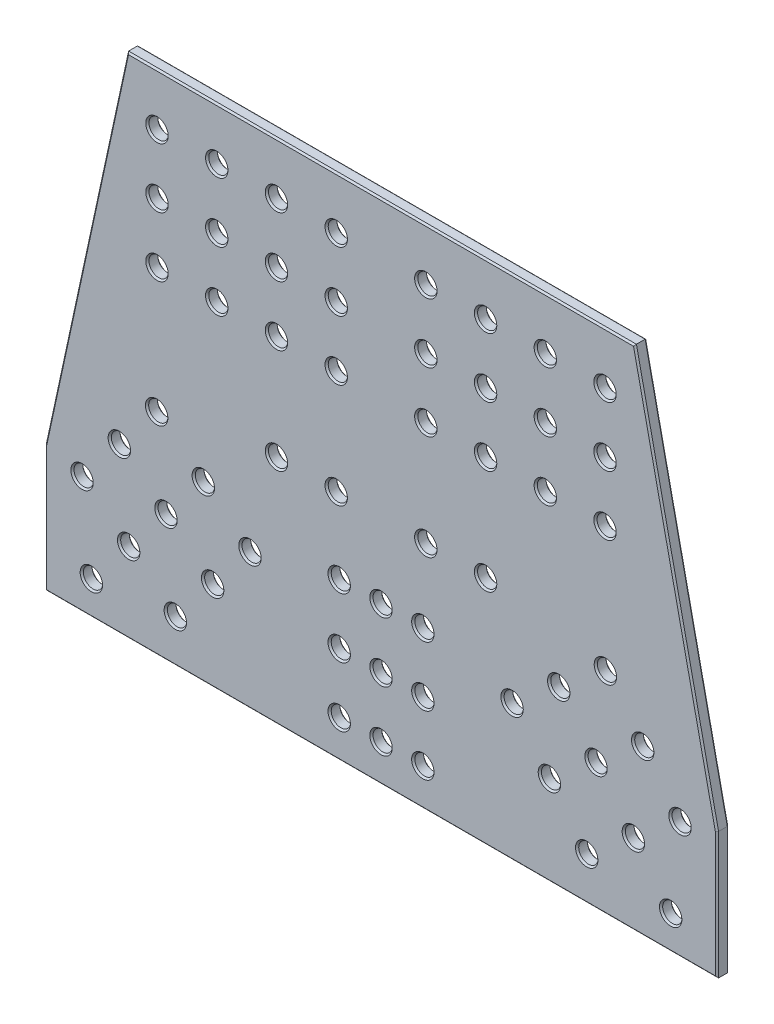
from build123d import *

# Parameters (mm, degrees)
SKETCH_2_R                        = 13
EXTRUDE_1206_DEPTH                = 16
SKETCH_3_R                        = 13
CUT_EXTRUDE_1_DEPTH               = 1129.120560933
PATTERN_LINEAR_1_COUNT            = 4
PATTERN_LINEAR_1_PITCH            = 80
PATTERN_LINEAR_1_COUNT_DIR2       = 3
PATTERN_LINEAR_1_PITCH_DIR2       = 80
PATTERN_LINEAR_2_COUNT            = 2
PATTERN_LINEAR_2_PITCH            = 360
PATTERN_LINEAR_2_COPY_1_SKETCH_R  = 13
PATTERN_LINEAR_2_COPY_1_DEPTH     = 1129.120560933
PATTERN_LINEAR_2_COPY_2_SKETCH_R  = 13
PATTERN_LINEAR_2_COPY_2_DEPTH     = 1129.120560933
PATTERN_LINEAR_2_COPY_3_SKETCH_R  = 13
PATTERN_LINEAR_2_COPY_3_DEPTH     = 1129.120560933
PATTERN_LINEAR_2_COPY_4_SKETCH_R  = 13
PATTERN_LINEAR_2_COPY_4_DEPTH     = 1129.120560933
PATTERN_LINEAR_2_COPY_5_SKETCH_R  = 13
PATTERN_LINEAR_2_COPY_5_DEPTH     = 1129.120560933
PATTERN_LINEAR_2_COPY_6_SKETCH_R  = 13
PATTERN_LINEAR_2_COPY_6_DEPTH     = 1129.120560933
PATTERN_LINEAR_2_COPY_7_SKETCH_R  = 13
PATTERN_LINEAR_2_COPY_7_DEPTH     = 1129.120560933
PATTERN_LINEAR_2_COPY_8_SKETCH_R  = 13
PATTERN_LINEAR_2_COPY_8_DEPTH     = 1129.120560933
PATTERN_LINEAR_2_COPY_9_SKETCH_R  = 13
PATTERN_LINEAR_2_COPY_9_DEPTH     = 1129.120560933
PATTERN_LINEAR_2_COPY_10_SKETCH_R = 13
PATTERN_LINEAR_2_COPY_10_DEPTH    = 1129.120560933
PATTERN_LINEAR_2_COPY_11_SKETCH_R = 13
PATTERN_LINEAR_2_COPY_11_DEPTH    = 1129.120560933
CHAMFER_11_SIZE                   = 2.300736814
CHAMFER_11_SIZE_2                 = 2


with BuildPart() as part:
    # 草图2 → Extrude 1206 (new body)
    with BuildSketch(Plane.XY):
        Polygon((110, 680), (0, 170), (0, 0), (900, 0), (900, 170), (790, 680), align=None)
        with Locations((450, 50)):
            Circle(SKETCH_2_R, mode=Mode.SUBTRACT)
        with Locations((450, 130)):
            Circle(SKETCH_2_R, mode=Mode.SUBTRACT)
        with Locations((450, 210)):
            Circle(SKETCH_2_R, mode=Mode.SUBTRACT)
        with Locations((837.882573403, 45.038033192)):
            Circle(SKETCH_2_R, mode=Mode.SUBTRACT)
        with Locations(Location((62.117426597, 45.038033192, 0), (0, 0, 180))):
            Circle(SKETCH_2_R, mode=Mode.SUBTRACT)
        with Locations((506, 210)):
            Circle(SKETCH_2_R, mode=Mode.SUBTRACT)
        with Locations((506, 130)):
            Circle(SKETCH_2_R, mode=Mode.SUBTRACT)
        with Locations((506, 50)):
            Circle(SKETCH_2_R, mode=Mode.SUBTRACT)
        with Locations(Location((394, 50, 0), (0, 0, 180))):
            Circle(SKETCH_2_R, mode=Mode.SUBTRACT)
        with Locations(Location((394, 130, 0), (0, 0, 180))):
            Circle(SKETCH_2_R, mode=Mode.SUBTRACT)
        with Locations(Location((394, 210, 0), (0, 0, 180))):
            Circle(SKETCH_2_R, mode=Mode.SUBTRACT)
        with Locations((510, 310)):
            Circle(SKETCH_2_R, mode=Mode.SUBTRACT)
        with Locations((590, 310)):
            Circle(SKETCH_2_R, mode=Mode.SUBTRACT)
        with Locations(Location((310, 310, 0), (0, 0, 180))):
            Circle(SKETCH_2_R, mode=Mode.SUBTRACT)
        with Locations(Location((390, 310, 0), (0, 0, 180))):
            Circle(SKETCH_2_R, mode=Mode.SUBTRACT)
        with Locations((750.451236411, 282.431717421)):
            Circle(SKETCH_2_R, mode=Mode.SUBTRACT)
        with Locations((687.976264841, 232.4629479)):
            Circle(SKETCH_2_R, mode=Mode.SUBTRACT)
        with Locations((800.420005931, 219.956745851)):
            Circle(SKETCH_2_R, mode=Mode.SUBTRACT)
        with Locations((850.388775452, 157.481774282)):
            Circle(SKETCH_2_R, mode=Mode.SUBTRACT)
        with Locations((787.913803882, 107.513004761)):
            Circle(SKETCH_2_R, mode=Mode.SUBTRACT)
        with Locations((737.945034362, 169.987976331)):
            Circle(SKETCH_2_R, mode=Mode.SUBTRACT)
        with Locations(Location((725.438832313, 57.544235241, 0), (0, 0, 180))):
            Circle(SKETCH_2_R, mode=Mode.SUBTRACT)
        with Locations(Location((675.470062792, 120.01920681, 0), (0, 0, 180))):
            Circle(SKETCH_2_R, mode=Mode.SUBTRACT)
        with Locations(Location((625.501293272, 182.49417838, 0), (0, 0, 180))):
            Circle(SKETCH_2_R, mode=Mode.SUBTRACT)
        with Locations((274.498706728, 182.49417838)):
            Circle(SKETCH_2_R, mode=Mode.SUBTRACT)
        with Locations((224.529937208, 120.01920681)):
            Circle(SKETCH_2_R, mode=Mode.SUBTRACT)
        with Locations((174.561167687, 57.544235241)):
            Circle(SKETCH_2_R, mode=Mode.SUBTRACT)
        with Locations(Location((162.054965638, 169.987976331, 0), (0, 0, 180))):
            Circle(SKETCH_2_R, mode=Mode.SUBTRACT)
        with Locations(Location((112.086196118, 107.513004761, 0), (0, 0, 180))):
            Circle(SKETCH_2_R, mode=Mode.SUBTRACT)
        with Locations(Location((49.611224548, 157.481774282, 0), (0, 0, 180))):
            Circle(SKETCH_2_R, mode=Mode.SUBTRACT)
        with Locations(Location((99.579994069, 219.956745851, 0), (0, 0, 180))):
            Circle(SKETCH_2_R, mode=Mode.SUBTRACT)
        with Locations(Location((212.023735159, 232.4629479, 0), (0, 0, 180))):
            Circle(SKETCH_2_R, mode=Mode.SUBTRACT)
        with Locations(Location((149.548763589, 282.431717421, 0), (0, 0, 180))):
            Circle(SKETCH_2_R, mode=Mode.SUBTRACT)
    extrude(amount=EXTRUDE_1206_DEPTH)

    # 草图3 → 切除-拉伸1 (cut, through all)
    with BuildSketch(Plane.XY.offset(16)):
        with Locations((750, 610)):
            Circle(SKETCH_3_R)
    cut_extrude_1 = extrude(amount=-CUT_EXTRUDE_1_DEPTH, mode=Mode.SUBTRACT)

    # 阵列(线性)1: Cut-Extrude 1 4 × 3
    with Locations(*[(-i * PATTERN_LINEAR_1_PITCH, -j * PATTERN_LINEAR_1_PITCH_DIR2, 0) for i in range(PATTERN_LINEAR_1_COUNT) for j in range(PATTERN_LINEAR_1_COUNT_DIR2) if (i, j) != (0, 0)]):
        add(cut_extrude_1, mode=Mode.SUBTRACT)

    # 阵列(线性)2: 切除-拉伸1 ×2
    with Locations(*[(-i * PATTERN_LINEAR_2_PITCH, 0, 0) for i in range(1, PATTERN_LINEAR_2_COUNT)]):
        add(cut_extrude_1, mode=Mode.SUBTRACT)

    # 阵列(线性)2 copy 1 sketch → 阵列(线性)2 copy 1 (cut, through all)
    with BuildSketch(Plane(origin=(-360, -80, 16), x_dir=(1, 0, 0), z_dir=(0, 0, 1))):
        with Locations((750, 610)):
            Circle(PATTERN_LINEAR_2_COPY_1_SKETCH_R)
    extrude(amount=-PATTERN_LINEAR_2_COPY_1_DEPTH, mode=Mode.SUBTRACT)

    # 阵列(线性)2 copy 2 sketch → 阵列(线性)2 copy 2 (cut, through all)
    with BuildSketch(Plane(origin=(-360, -160, 16), x_dir=(1, 0, 0), z_dir=(0, 0, 1))):
        with Locations((750, 610)):
            Circle(PATTERN_LINEAR_2_COPY_2_SKETCH_R)
    extrude(amount=-PATTERN_LINEAR_2_COPY_2_DEPTH, mode=Mode.SUBTRACT)

    # 阵列(线性)2 copy 3 sketch → 阵列(线性)2 copy 3 (cut, through all)
    with BuildSketch(Plane(origin=(-440, 0, 16), x_dir=(1, 0, 0), z_dir=(0, 0, 1))):
        with Locations((750, 610)):
            Circle(PATTERN_LINEAR_2_COPY_3_SKETCH_R)
    extrude(amount=-PATTERN_LINEAR_2_COPY_3_DEPTH, mode=Mode.SUBTRACT)

    # 阵列(线性)2 copy 4 sketch → 阵列(线性)2 copy 4 (cut, through all)
    with BuildSketch(Plane(origin=(-440, -80, 16), x_dir=(1, 0, 0), z_dir=(0, 0, 1))):
        with Locations((750, 610)):
            Circle(PATTERN_LINEAR_2_COPY_4_SKETCH_R)
    extrude(amount=-PATTERN_LINEAR_2_COPY_4_DEPTH, mode=Mode.SUBTRACT)

    # 阵列(线性)2 copy 5 sketch → 阵列(线性)2 copy 5 (cut, through all)
    with BuildSketch(Plane(origin=(-440, -160, 16), x_dir=(1, 0, 0), z_dir=(0, 0, 1))):
        with Locations((750, 610)):
            Circle(PATTERN_LINEAR_2_COPY_5_SKETCH_R)
    extrude(amount=-PATTERN_LINEAR_2_COPY_5_DEPTH, mode=Mode.SUBTRACT)

    # 阵列(线性)2 copy 6 sketch → 阵列(线性)2 copy 6 (cut, through all)
    with BuildSketch(Plane(origin=(-520, 0, 16), x_dir=(1, 0, 0), z_dir=(0, 0, 1))):
        with Locations((750, 610)):
            Circle(PATTERN_LINEAR_2_COPY_6_SKETCH_R)
    extrude(amount=-PATTERN_LINEAR_2_COPY_6_DEPTH, mode=Mode.SUBTRACT)

    # 阵列(线性)2 copy 7 sketch → 阵列(线性)2 copy 7 (cut, through all)
    with BuildSketch(Plane(origin=(-520, -80, 16), x_dir=(1, 0, 0), z_dir=(0, 0, 1))):
        with Locations((750, 610)):
            Circle(PATTERN_LINEAR_2_COPY_7_SKETCH_R)
    extrude(amount=-PATTERN_LINEAR_2_COPY_7_DEPTH, mode=Mode.SUBTRACT)

    # 阵列(线性)2 copy 8 sketch → 阵列(线性)2 copy 8 (cut, through all)
    with BuildSketch(Plane(origin=(-520, -160, 16), x_dir=(1, 0, 0), z_dir=(0, 0, 1))):
        with Locations((750, 610)):
            Circle(PATTERN_LINEAR_2_COPY_8_SKETCH_R)
    extrude(amount=-PATTERN_LINEAR_2_COPY_8_DEPTH, mode=Mode.SUBTRACT)

    # 阵列(线性)2 copy 9 sketch → 阵列(线性)2 copy 9 (cut, through all)
    with BuildSketch(Plane(origin=(-600, 0, 16), x_dir=(1, 0, 0), z_dir=(0, 0, 1))):
        with Locations((750, 610)):
            Circle(PATTERN_LINEAR_2_COPY_9_SKETCH_R)
    extrude(amount=-PATTERN_LINEAR_2_COPY_9_DEPTH, mode=Mode.SUBTRACT)

    # 阵列(线性)2 copy 10 sketch → 阵列(线性)2 copy 10 (cut, through all)
    with BuildSketch(Plane(origin=(-600, -80, 16), x_dir=(1, 0, 0), z_dir=(0, 0, 1))):
        with Locations((750, 610)):
            Circle(PATTERN_LINEAR_2_COPY_10_SKETCH_R)
    extrude(amount=-PATTERN_LINEAR_2_COPY_10_DEPTH, mode=Mode.SUBTRACT)

    # 阵列(线性)2 copy 11 sketch → 阵列(线性)2 copy 11 (cut, through all)
    with BuildSketch(Plane(origin=(-600, -160, 16), x_dir=(1, 0, 0), z_dir=(0, 0, 1))):
        with Locations((750, 610)):
            Circle(PATTERN_LINEAR_2_COPY_11_SKETCH_R)
    extrude(amount=-PATTERN_LINEAR_2_COPY_11_DEPTH, mode=Mode.SUBTRACT)

    # 倒角11
    # the kernel refuses this chamfer: 2.300736814, 2 mm, written as the material it takes off along each edge
    with BuildSketch(Plane(origin=(900, -5.927403035, 16), x_dir=(-1, 0, 0), z_dir=(0, 1, 0))) as chamfer_11_piece_1:
        Polygon((CHAMFER_11_SIZE, 0), (0, -CHAMFER_11_SIZE_2), (0, 0), align=None)
    extrude(amount=193.70961214, mode=Mode.SUBTRACT)
    with BuildSketch(Plane(origin=(274.498706728, 182.49417838, 0), x_dir=(1, 0, 0), z_dir=(0, -1, 0))) as chamfer_11_piece_2:
        Polygon((13 + CHAMFER_11_SIZE, 0), (13, CHAMFER_11_SIZE_2), (13, 0), align=None)
    revolve(axis=Axis((274.498706728, 182.49417838, 0), (0, 0, 1)), mode=Mode.SUBTRACT)
    with BuildSketch(Plane(origin=(274.498706728, 182.49417838, 16), x_dir=(1, 0, 0), z_dir=(0, -1, 0))) as chamfer_11_piece_3:
        Polygon((13 + CHAMFER_11_SIZE_2, 0), (13, -CHAMFER_11_SIZE), (13, 0), align=None)
    revolve(axis=Axis((274.498706728, 182.49417838, 16), (0, 0, 1)), mode=Mode.SUBTRACT)
    with BuildSketch(Plane(origin=(224.529937208, 120.01920681, 0), x_dir=(1, 0, 0), z_dir=(0, -1, 0))) as chamfer_11_piece_4:
        Polygon((13 + CHAMFER_11_SIZE, 0), (13, CHAMFER_11_SIZE_2), (13, 0), align=None)
    revolve(axis=Axis((224.529937208, 120.01920681, 0), (0, 0, 1)), mode=Mode.SUBTRACT)
    with BuildSketch(Plane(origin=(224.529937208, 120.01920681, 16), x_dir=(1, 0, 0), z_dir=(0, -1, 0))) as chamfer_11_piece_5:
        Polygon((13 + CHAMFER_11_SIZE_2, 0), (13, -CHAMFER_11_SIZE), (13, 0), align=None)
    revolve(axis=Axis((224.529937208, 120.01920681, 16), (0, 0, 1)), mode=Mode.SUBTRACT)
    with BuildSketch(Plane(origin=(174.561167687, 57.544235241, 0), x_dir=(1, 0, 0), z_dir=(0, -1, 0))) as chamfer_11_piece_6:
        Polygon((13 + CHAMFER_11_SIZE, 0), (13, CHAMFER_11_SIZE_2), (13, 0), align=None)
    revolve(axis=Axis((174.561167687, 57.544235241, 0), (0, 0, 1)), mode=Mode.SUBTRACT)
    with BuildSketch(Plane(origin=(174.561167687, 57.544235241, 16), x_dir=(1, 0, 0), z_dir=(0, -1, 0))) as chamfer_11_piece_7:
        Polygon((13 + CHAMFER_11_SIZE_2, 0), (13, -CHAMFER_11_SIZE), (13, 0), align=None)
    revolve(axis=Axis((174.561167687, 57.544235241, 16), (0, 0, 1)), mode=Mode.SUBTRACT)
    with BuildSketch(Plane(origin=(162.054965638, 169.987976331, 0), x_dir=(-1, 0, 0), z_dir=(0, 1, 0))) as chamfer_11_piece_8:
        Polygon((13 + CHAMFER_11_SIZE, 0), (13, CHAMFER_11_SIZE_2), (13, 0), align=None)
    revolve(axis=Axis((162.054965638, 169.987976331, 0), (0, 0, 1)), mode=Mode.SUBTRACT)
    with BuildSketch(Plane(origin=(162.054965638, 169.987976331, 16), x_dir=(-1, 0, 0), z_dir=(0, 1, 0))) as chamfer_11_piece_9:
        Polygon((13 + CHAMFER_11_SIZE_2, 0), (13, -CHAMFER_11_SIZE), (13, 0), align=None)
    revolve(axis=Axis((162.054965638, 169.987976331, 16), (0, 0, 1)), mode=Mode.SUBTRACT)
    with BuildSketch(Plane(origin=(112.086196118, 107.513004761, 0), x_dir=(-1, 0, 0), z_dir=(0, 1, 0))) as chamfer_11_piece_10:
        Polygon((13 + CHAMFER_11_SIZE, 0), (13, CHAMFER_11_SIZE_2), (13, 0), align=None)
    revolve(axis=Axis((112.086196118, 107.513004761, 0), (0, 0, 1)), mode=Mode.SUBTRACT)
    with BuildSketch(Plane(origin=(112.086196118, 107.513004761, 16), x_dir=(-1, 0, 0), z_dir=(0, 1, 0))) as chamfer_11_piece_11:
        Polygon((13 + CHAMFER_11_SIZE_2, 0), (13, -CHAMFER_11_SIZE), (13, 0), align=None)
    revolve(axis=Axis((112.086196118, 107.513004761, 16), (0, 0, 1)), mode=Mode.SUBTRACT)
    with BuildSketch(Plane(origin=(49.611224548, 157.481774282, 0), x_dir=(-1, 0, 0), z_dir=(0, 1, 0))) as chamfer_11_piece_12:
        Polygon((13 + CHAMFER_11_SIZE, 0), (13, CHAMFER_11_SIZE_2), (13, 0), align=None)
    revolve(axis=Axis((49.611224548, 157.481774282, 0), (0, 0, 1)), mode=Mode.SUBTRACT)
    with BuildSketch(Plane(origin=(49.611224548, 157.481774282, 16), x_dir=(-1, 0, 0), z_dir=(0, 1, 0))) as chamfer_11_piece_13:
        Polygon((13 + CHAMFER_11_SIZE_2, 0), (13, -CHAMFER_11_SIZE), (13, 0), align=None)
    revolve(axis=Axis((49.611224548, 157.481774282, 16), (0, 0, 1)), mode=Mode.SUBTRACT)
    with BuildSketch(Plane(origin=(99.579994069, 219.956745851, 0), x_dir=(-1, 0, 0), z_dir=(0, 1, 0))) as chamfer_11_piece_14:
        Polygon((13 + CHAMFER_11_SIZE, 0), (13, CHAMFER_11_SIZE_2), (13, 0), align=None)
    revolve(axis=Axis((99.579994069, 219.956745851, 0), (0, 0, 1)), mode=Mode.SUBTRACT)
    with BuildSketch(Plane(origin=(99.579994069, 219.956745851, 16), x_dir=(-1, 0, 0), z_dir=(0, 1, 0))) as chamfer_11_piece_15:
        Polygon((13 + CHAMFER_11_SIZE_2, 0), (13, -CHAMFER_11_SIZE), (13, 0), align=None)
    revolve(axis=Axis((99.579994069, 219.956745851, 16), (0, 0, 1)), mode=Mode.SUBTRACT)
    with BuildSketch(Plane(origin=(212.023735159, 232.4629479, 0), x_dir=(-1, 0, 0), z_dir=(0, 1, 0))) as chamfer_11_piece_16:
        Polygon((13 + CHAMFER_11_SIZE, 0), (13, CHAMFER_11_SIZE_2), (13, 0), align=None)
    revolve(axis=Axis((212.023735159, 232.4629479, 0), (0, 0, 1)), mode=Mode.SUBTRACT)
    with BuildSketch(Plane(origin=(212.023735159, 232.4629479, 16), x_dir=(-1, 0, 0), z_dir=(0, 1, 0))) as chamfer_11_piece_17:
        Polygon((13 + CHAMFER_11_SIZE_2, 0), (13, -CHAMFER_11_SIZE), (13, 0), align=None)
    revolve(axis=Axis((212.023735159, 232.4629479, 16), (0, 0, 1)), mode=Mode.SUBTRACT)
    with BuildSketch(Plane(origin=(903.749163132, 152.61751639, 16), x_dir=(-0.9775210440823286, -0.21083787225305164, 0), z_dir=(-0.21083787225305164, 0.9775210440823286, 0))) as chamfer_11_piece_18:
        Polygon((CHAMFER_11_SIZE, 0), (0, -CHAMFER_11_SIZE_2), (0, 0), align=None)
    extrude(amount=545.437510569, mode=Mode.SUBTRACT)
    with BuildSketch(Plane(origin=(149.548763589, 282.431717421, 0), x_dir=(-1, 0, 0), z_dir=(0, 1, 0))) as chamfer_11_piece_19:
        Polygon((13 + CHAMFER_11_SIZE, 0), (13, CHAMFER_11_SIZE_2), (13, 0), align=None)
    revolve(axis=Axis((149.548763589, 282.431717421, 0), (0, 0, 1)), mode=Mode.SUBTRACT)
    with BuildSketch(Plane(origin=(149.548763589, 282.431717421, 16), x_dir=(-1, 0, 0), z_dir=(0, 1, 0))) as chamfer_11_piece_20:
        Polygon((13 + CHAMFER_11_SIZE_2, 0), (13, -CHAMFER_11_SIZE), (13, 0), align=None)
    revolve(axis=Axis((149.548763589, 282.431717421, 16), (0, 0, 1)), mode=Mode.SUBTRACT)
    with BuildSketch(Plane(origin=(394, 130, 0), x_dir=(-1, 0, 0), z_dir=(0, 1, 0))) as chamfer_11_piece_21:
        Polygon((13 + CHAMFER_11_SIZE, 0), (13, CHAMFER_11_SIZE_2), (13, 0), align=None)
    revolve(axis=Axis((394, 130, 0), (0, 0, 1)), mode=Mode.SUBTRACT)
    with BuildSketch(Plane(origin=(394, 130, 16), x_dir=(-1, 0, 0), z_dir=(0, 1, 0))) as chamfer_11_piece_22:
        Polygon((13 + CHAMFER_11_SIZE_2, 0), (13, -CHAMFER_11_SIZE), (13, 0), align=None)
    revolve(axis=Axis((394, 130, 16), (0, 0, 1)), mode=Mode.SUBTRACT)
    with BuildSketch(Plane(origin=(394, 210, 0), x_dir=(-1, 0, 0), z_dir=(0, 1, 0))) as chamfer_11_piece_23:
        Polygon((13 + CHAMFER_11_SIZE, 0), (13, CHAMFER_11_SIZE_2), (13, 0), align=None)
    revolve(axis=Axis((394, 210, 0), (0, 0, 1)), mode=Mode.SUBTRACT)
    with BuildSketch(Plane(origin=(394, 210, 16), x_dir=(-1, 0, 0), z_dir=(0, 1, 0))) as chamfer_11_piece_24:
        Polygon((13 + CHAMFER_11_SIZE_2, 0), (13, -CHAMFER_11_SIZE), (13, 0), align=None)
    revolve(axis=Axis((394, 210, 16), (0, 0, 1)), mode=Mode.SUBTRACT)
    with BuildSketch(Plane(origin=(750, 610, 0), x_dir=(1, 0, 0), z_dir=(0, -1, 0))) as chamfer_11_piece_25:
        Polygon((13 + CHAMFER_11_SIZE, 0), (13, CHAMFER_11_SIZE_2), (13, 0), align=None)
    revolve(axis=Axis((750, 610, 0), (0, 0, 1)), mode=Mode.SUBTRACT)
    with BuildSketch(Plane(origin=(750, 610, 16), x_dir=(1, 0, 0), z_dir=(0, -1, 0))) as chamfer_11_piece_26:
        Polygon((13 + CHAMFER_11_SIZE_2, 0), (13, -CHAMFER_11_SIZE), (13, 0), align=None)
    revolve(axis=Axis((750, 610, 16), (0, 0, 1)), mode=Mode.SUBTRACT)
    with BuildSketch(Plane(origin=(795.927403035, 680, 16), x_dir=(0, 0, -1), z_dir=(-1, 0, 0))) as chamfer_11_piece_27:
        Polygon((CHAMFER_11_SIZE_2, 0), (0, CHAMFER_11_SIZE), (0, 0), align=None)
    extrude(amount=691.85480607, mode=Mode.SUBTRACT)
    with BuildSketch(Plane(origin=(670, 530, 16), x_dir=(1, 0, 0), z_dir=(0, -1, 0))) as chamfer_11_piece_28:
        Polygon((13 + CHAMFER_11_SIZE_2, 0), (13, -CHAMFER_11_SIZE), (13, 0), align=None)
    revolve(axis=Axis((670, 530, 16), (0, 0, 1)), mode=Mode.SUBTRACT)
    with BuildSketch(Plane(origin=(670, 530, 0), x_dir=(1, 0, 0), z_dir=(0, -1, 0))) as chamfer_11_piece_29:
        Polygon((13 + CHAMFER_11_SIZE, 0), (13, CHAMFER_11_SIZE_2), (13, 0), align=None)
    revolve(axis=Axis((670, 530, 0), (0, 0, 1)), mode=Mode.SUBTRACT)
    with BuildSketch(Plane(origin=(450, 50, 0), x_dir=(1, 0, 0), z_dir=(0, -1, 0))) as chamfer_11_piece_30:
        Polygon((13 + CHAMFER_11_SIZE, 0), (13, CHAMFER_11_SIZE_2), (13, 0), align=None)
    revolve(axis=Axis((450, 50, 0), (0, 0, 1)), mode=Mode.SUBTRACT)
    with BuildSketch(Plane(origin=(590, 530, 0), x_dir=(1, 0, 0), z_dir=(0, -1, 0))) as chamfer_11_piece_31:
        Polygon((13 + CHAMFER_11_SIZE, 0), (13, CHAMFER_11_SIZE_2), (13, 0), align=None)
    revolve(axis=Axis((590, 530, 0), (0, 0, 1)), mode=Mode.SUBTRACT)
    with BuildSketch(Plane(origin=(590, 530, 16), x_dir=(1, 0, 0), z_dir=(0, -1, 0))) as chamfer_11_piece_32:
        Polygon((13 + CHAMFER_11_SIZE_2, 0), (13, -CHAMFER_11_SIZE), (13, 0), align=None)
    revolve(axis=Axis((590, 530, 16), (0, 0, 1)), mode=Mode.SUBTRACT)
    with BuildSketch(Plane(origin=(450, 50, 16), x_dir=(1, 0, 0), z_dir=(0, -1, 0))) as chamfer_11_piece_33:
        Polygon((13 + CHAMFER_11_SIZE_2, 0), (13, -CHAMFER_11_SIZE), (13, 0), align=None)
    revolve(axis=Axis((450, 50, 16), (0, 0, 1)), mode=Mode.SUBTRACT)
    with BuildSketch(Plane(origin=(670, 610, 16), x_dir=(1, 0, 0), z_dir=(0, -1, 0))) as chamfer_11_piece_34:
        Polygon((13 + CHAMFER_11_SIZE_2, 0), (13, -CHAMFER_11_SIZE), (13, 0), align=None)
    revolve(axis=Axis((670, 610, 16), (0, 0, 1)), mode=Mode.SUBTRACT)
    with BuildSketch(Plane(origin=(670, 610, 0), x_dir=(1, 0, 0), z_dir=(0, -1, 0))) as chamfer_11_piece_35:
        Polygon((13 + CHAMFER_11_SIZE, 0), (13, CHAMFER_11_SIZE_2), (13, 0), align=None)
    revolve(axis=Axis((670, 610, 0), (0, 0, 1)), mode=Mode.SUBTRACT)
    with BuildSketch(Plane(origin=(590, 610, 0), x_dir=(1, 0, 0), z_dir=(0, -1, 0))) as chamfer_11_piece_36:
        Polygon((13 + CHAMFER_11_SIZE, 0), (13, CHAMFER_11_SIZE_2), (13, 0), align=None)
    revolve(axis=Axis((590, 610, 0), (0, 0, 1)), mode=Mode.SUBTRACT)
    with BuildSketch(Plane(origin=(590, 610, 16), x_dir=(1, 0, 0), z_dir=(0, -1, 0))) as chamfer_11_piece_37:
        Polygon((13 + CHAMFER_11_SIZE_2, 0), (13, -CHAMFER_11_SIZE), (13, 0), align=None)
    revolve(axis=Axis((590, 610, 16), (0, 0, 1)), mode=Mode.SUBTRACT)
    with BuildSketch(Plane(origin=(510, 610, 0), x_dir=(1, 0, 0), z_dir=(0, -1, 0))) as chamfer_11_piece_38:
        Polygon((13 + CHAMFER_11_SIZE, 0), (13, CHAMFER_11_SIZE_2), (13, 0), align=None)
    revolve(axis=Axis((510, 610, 0), (0, 0, 1)), mode=Mode.SUBTRACT)
    with BuildSketch(Plane(origin=(510, 610, 16), x_dir=(1, 0, 0), z_dir=(0, -1, 0))) as chamfer_11_piece_39:
        Polygon((13 + CHAMFER_11_SIZE_2, 0), (13, -CHAMFER_11_SIZE), (13, 0), align=None)
    revolve(axis=Axis((510, 610, 16), (0, 0, 1)), mode=Mode.SUBTRACT)
    with BuildSketch(Plane(origin=(750, 530, 0), x_dir=(1, 0, 0), z_dir=(0, -1, 0))) as chamfer_11_piece_40:
        Polygon((13 + CHAMFER_11_SIZE, 0), (13, CHAMFER_11_SIZE_2), (13, 0), align=None)
    revolve(axis=Axis((750, 530, 0), (0, 0, 1)), mode=Mode.SUBTRACT)
    with BuildSketch(Plane(origin=(750, 530, 16), x_dir=(1, 0, 0), z_dir=(0, -1, 0))) as chamfer_11_piece_41:
        Polygon((13 + CHAMFER_11_SIZE_2, 0), (13, -CHAMFER_11_SIZE), (13, 0), align=None)
    revolve(axis=Axis((750, 530, 16), (0, 0, 1)), mode=Mode.SUBTRACT)
    with BuildSketch(Plane(origin=(510, 530, 0), x_dir=(1, 0, 0), z_dir=(0, -1, 0))) as chamfer_11_piece_42:
        Polygon((13 + CHAMFER_11_SIZE, 0), (13, CHAMFER_11_SIZE_2), (13, 0), align=None)
    revolve(axis=Axis((510, 530, 0), (0, 0, 1)), mode=Mode.SUBTRACT)
    with BuildSketch(Plane(origin=(510, 530, 16), x_dir=(1, 0, 0), z_dir=(0, -1, 0))) as chamfer_11_piece_43:
        Polygon((13 + CHAMFER_11_SIZE_2, 0), (13, -CHAMFER_11_SIZE), (13, 0), align=None)
    revolve(axis=Axis((510, 530, 16), (0, 0, 1)), mode=Mode.SUBTRACT)
    with BuildSketch(Plane(origin=(750, 450, 0), x_dir=(1, 0, 0), z_dir=(0, -1, 0))) as chamfer_11_piece_44:
        Polygon((13 + CHAMFER_11_SIZE, 0), (13, CHAMFER_11_SIZE_2), (13, 0), align=None)
    revolve(axis=Axis((750, 450, 0), (0, 0, 1)), mode=Mode.SUBTRACT)
    with BuildSketch(Plane(origin=(750, 450, 16), x_dir=(1, 0, 0), z_dir=(0, -1, 0))) as chamfer_11_piece_45:
        Polygon((13 + CHAMFER_11_SIZE_2, 0), (13, -CHAMFER_11_SIZE), (13, 0), align=None)
    revolve(axis=Axis((750, 450, 16), (0, 0, 1)), mode=Mode.SUBTRACT)
    with BuildSketch(Plane(origin=(670, 450, 0), x_dir=(1, 0, 0), z_dir=(0, -1, 0))) as chamfer_11_piece_46:
        Polygon((13 + CHAMFER_11_SIZE, 0), (13, CHAMFER_11_SIZE_2), (13, 0), align=None)
    revolve(axis=Axis((670, 450, 0), (0, 0, 1)), mode=Mode.SUBTRACT)
    with BuildSketch(Plane(origin=(670, 450, 16), x_dir=(1, 0, 0), z_dir=(0, -1, 0))) as chamfer_11_piece_47:
        Polygon((13 + CHAMFER_11_SIZE_2, 0), (13, -CHAMFER_11_SIZE), (13, 0), align=None)
    revolve(axis=Axis((670, 450, 16), (0, 0, 1)), mode=Mode.SUBTRACT)
    with BuildSketch(Plane(origin=(590, 450, 0), x_dir=(1, 0, 0), z_dir=(0, -1, 0))) as chamfer_11_piece_48:
        Polygon((13 + CHAMFER_11_SIZE, 0), (13, CHAMFER_11_SIZE_2), (13, 0), align=None)
    revolve(axis=Axis((590, 450, 0), (0, 0, 1)), mode=Mode.SUBTRACT)
    with BuildSketch(Plane(origin=(590, 450, 16), x_dir=(1, 0, 0), z_dir=(0, -1, 0))) as chamfer_11_piece_49:
        Polygon((13 + CHAMFER_11_SIZE_2, 0), (13, -CHAMFER_11_SIZE), (13, 0), align=None)
    revolve(axis=Axis((590, 450, 16), (0, 0, 1)), mode=Mode.SUBTRACT)
    with BuildSketch(Plane(origin=(510, 450, 0), x_dir=(1, 0, 0), z_dir=(0, -1, 0))) as chamfer_11_piece_50:
        Polygon((13 + CHAMFER_11_SIZE, 0), (13, CHAMFER_11_SIZE_2), (13, 0), align=None)
    revolve(axis=Axis((510, 450, 0), (0, 0, 1)), mode=Mode.SUBTRACT)
    with BuildSketch(Plane(origin=(510, 450, 16), x_dir=(1, 0, 0), z_dir=(0, -1, 0))) as chamfer_11_piece_51:
        Polygon((13 + CHAMFER_11_SIZE_2, 0), (13, -CHAMFER_11_SIZE), (13, 0), align=None)
    revolve(axis=Axis((510, 450, 16), (0, 0, 1)), mode=Mode.SUBTRACT)
    with BuildSketch(Plane(origin=(111.249721044, 685.794161203, 16), x_dir=(0, 0, -1), z_dir=(-0.2108378722530513, -0.9775210440823288, 0))) as chamfer_11_piece_52:
        Polygon((CHAMFER_11_SIZE_2, 0), (0, CHAMFER_11_SIZE), (0, 0), align=None)
    extrude(amount=545.437510569, mode=Mode.SUBTRACT)
    with BuildSketch(Plane(origin=(390, 610, 0), x_dir=(1, 0, 0), z_dir=(0, -1, 0))) as chamfer_11_piece_53:
        Polygon((13 + CHAMFER_11_SIZE, 0), (13, CHAMFER_11_SIZE_2), (13, 0), align=None)
    revolve(axis=Axis((390, 610, 0), (0, 0, 1)), mode=Mode.SUBTRACT)
    with BuildSketch(Plane(origin=(390, 610, 16), x_dir=(1, 0, 0), z_dir=(0, -1, 0))) as chamfer_11_piece_54:
        Polygon((13 + CHAMFER_11_SIZE_2, 0), (13, -CHAMFER_11_SIZE), (13, 0), align=None)
    revolve(axis=Axis((390, 610, 16), (0, 0, 1)), mode=Mode.SUBTRACT)
    with BuildSketch(Plane(origin=(390, 530, 0), x_dir=(1, 0, 0), z_dir=(0, -1, 0))) as chamfer_11_piece_55:
        Polygon((13 + CHAMFER_11_SIZE, 0), (13, CHAMFER_11_SIZE_2), (13, 0), align=None)
    revolve(axis=Axis((390, 530, 0), (0, 0, 1)), mode=Mode.SUBTRACT)
    with BuildSketch(Plane(origin=(390, 530, 16), x_dir=(1, 0, 0), z_dir=(0, -1, 0))) as chamfer_11_piece_56:
        Polygon((13 + CHAMFER_11_SIZE_2, 0), (13, -CHAMFER_11_SIZE), (13, 0), align=None)
    revolve(axis=Axis((390, 530, 16), (0, 0, 1)), mode=Mode.SUBTRACT)
    with BuildSketch(Plane(origin=(390, 450, 0), x_dir=(1, 0, 0), z_dir=(0, -1, 0))) as chamfer_11_piece_57:
        Polygon((13 + CHAMFER_11_SIZE, 0), (13, CHAMFER_11_SIZE_2), (13, 0), align=None)
    revolve(axis=Axis((390, 450, 0), (0, 0, 1)), mode=Mode.SUBTRACT)
    with BuildSketch(Plane(origin=(390, 450, 16), x_dir=(1, 0, 0), z_dir=(0, -1, 0))) as chamfer_11_piece_58:
        Polygon((13 + CHAMFER_11_SIZE_2, 0), (13, -CHAMFER_11_SIZE), (13, 0), align=None)
    revolve(axis=Axis((390, 450, 16), (0, 0, 1)), mode=Mode.SUBTRACT)
    with BuildSketch(Plane(origin=(310, 610, 0), x_dir=(1, 0, 0), z_dir=(0, -1, 0))) as chamfer_11_piece_59:
        Polygon((13 + CHAMFER_11_SIZE, 0), (13, CHAMFER_11_SIZE_2), (13, 0), align=None)
    revolve(axis=Axis((310, 610, 0), (0, 0, 1)), mode=Mode.SUBTRACT)
    with BuildSketch(Plane(origin=(310, 610, 16), x_dir=(1, 0, 0), z_dir=(0, -1, 0))) as chamfer_11_piece_60:
        Polygon((13 + CHAMFER_11_SIZE_2, 0), (13, -CHAMFER_11_SIZE), (13, 0), align=None)
    revolve(axis=Axis((310, 610, 16), (0, 0, 1)), mode=Mode.SUBTRACT)
    with BuildSketch(Plane(origin=(450, 130, 0), x_dir=(1, 0, 0), z_dir=(0, -1, 0))) as chamfer_11_piece_61:
        Polygon((13 + CHAMFER_11_SIZE, 0), (13, CHAMFER_11_SIZE_2), (13, 0), align=None)
    revolve(axis=Axis((450, 130, 0), (0, 0, 1)), mode=Mode.SUBTRACT)
    with BuildSketch(Plane(origin=(450, 130, 16), x_dir=(1, 0, 0), z_dir=(0, -1, 0))) as chamfer_11_piece_62:
        Polygon((13 + CHAMFER_11_SIZE_2, 0), (13, -CHAMFER_11_SIZE), (13, 0), align=None)
    revolve(axis=Axis((450, 130, 16), (0, 0, 1)), mode=Mode.SUBTRACT)
    with BuildSketch(Plane(origin=(310, 530, 0), x_dir=(1, 0, 0), z_dir=(0, -1, 0))) as chamfer_11_piece_63:
        Polygon((13 + CHAMFER_11_SIZE, 0), (13, CHAMFER_11_SIZE_2), (13, 0), align=None)
    revolve(axis=Axis((310, 530, 0), (0, 0, 1)), mode=Mode.SUBTRACT)
    with BuildSketch(Plane(origin=(310, 530, 16), x_dir=(1, 0, 0), z_dir=(0, -1, 0))) as chamfer_11_piece_64:
        Polygon((13 + CHAMFER_11_SIZE_2, 0), (13, -CHAMFER_11_SIZE), (13, 0), align=None)
    revolve(axis=Axis((310, 530, 16), (0, 0, 1)), mode=Mode.SUBTRACT)
    with BuildSketch(Plane(origin=(310, 450, 0), x_dir=(1, 0, 0), z_dir=(0, -1, 0))) as chamfer_11_piece_65:
        Polygon((13 + CHAMFER_11_SIZE, 0), (13, CHAMFER_11_SIZE_2), (13, 0), align=None)
    revolve(axis=Axis((310, 450, 0), (0, 0, 1)), mode=Mode.SUBTRACT)
    with BuildSketch(Plane(origin=(310, 450, 16), x_dir=(1, 0, 0), z_dir=(0, -1, 0))) as chamfer_11_piece_66:
        Polygon((13 + CHAMFER_11_SIZE_2, 0), (13, -CHAMFER_11_SIZE), (13, 0), align=None)
    revolve(axis=Axis((310, 450, 16), (0, 0, 1)), mode=Mode.SUBTRACT)
    with BuildSketch(Plane(origin=(230, 610, 0), x_dir=(1, 0, 0), z_dir=(0, -1, 0))) as chamfer_11_piece_67:
        Polygon((13 + CHAMFER_11_SIZE, 0), (13, CHAMFER_11_SIZE_2), (13, 0), align=None)
    revolve(axis=Axis((230, 610, 0), (0, 0, 1)), mode=Mode.SUBTRACT)
    with BuildSketch(Plane(origin=(230, 610, 16), x_dir=(1, 0, 0), z_dir=(0, -1, 0))) as chamfer_11_piece_68:
        Polygon((13 + CHAMFER_11_SIZE_2, 0), (13, -CHAMFER_11_SIZE), (13, 0), align=None)
    revolve(axis=Axis((230, 610, 16), (0, 0, 1)), mode=Mode.SUBTRACT)
    with BuildSketch(Plane(origin=(230, 530, 0), x_dir=(1, 0, 0), z_dir=(0, -1, 0))) as chamfer_11_piece_69:
        Polygon((13 + CHAMFER_11_SIZE, 0), (13, CHAMFER_11_SIZE_2), (13, 0), align=None)
    revolve(axis=Axis((230, 530, 0), (0, 0, 1)), mode=Mode.SUBTRACT)
    with BuildSketch(Plane(origin=(230, 530, 16), x_dir=(1, 0, 0), z_dir=(0, -1, 0))) as chamfer_11_piece_70:
        Polygon((13 + CHAMFER_11_SIZE_2, 0), (13, -CHAMFER_11_SIZE), (13, 0), align=None)
    revolve(axis=Axis((230, 530, 16), (0, 0, 1)), mode=Mode.SUBTRACT)
    with BuildSketch(Plane(origin=(230, 450, 0), x_dir=(1, 0, 0), z_dir=(0, -1, 0))) as chamfer_11_piece_71:
        Polygon((13 + CHAMFER_11_SIZE, 0), (13, CHAMFER_11_SIZE_2), (13, 0), align=None)
    revolve(axis=Axis((230, 450, 0), (0, 0, 1)), mode=Mode.SUBTRACT)
    with BuildSketch(Plane(origin=(230, 450, 16), x_dir=(1, 0, 0), z_dir=(0, -1, 0))) as chamfer_11_piece_72:
        Polygon((13 + CHAMFER_11_SIZE_2, 0), (13, -CHAMFER_11_SIZE), (13, 0), align=None)
    revolve(axis=Axis((230, 450, 16), (0, 0, 1)), mode=Mode.SUBTRACT)
    with BuildSketch(Plane(origin=(150, 610, 0), x_dir=(1, 0, 0), z_dir=(0, -1, 0))) as chamfer_11_piece_73:
        Polygon((13 + CHAMFER_11_SIZE, 0), (13, CHAMFER_11_SIZE_2), (13, 0), align=None)
    revolve(axis=Axis((150, 610, 0), (0, 0, 1)), mode=Mode.SUBTRACT)
    with BuildSketch(Plane(origin=(150, 610, 16), x_dir=(1, 0, 0), z_dir=(0, -1, 0))) as chamfer_11_piece_74:
        Polygon((13 + CHAMFER_11_SIZE_2, 0), (13, -CHAMFER_11_SIZE), (13, 0), align=None)
    revolve(axis=Axis((150, 610, 16), (0, 0, 1)), mode=Mode.SUBTRACT)
    with BuildSketch(Plane(origin=(150, 530, 0), x_dir=(1, 0, 0), z_dir=(0, -1, 0))) as chamfer_11_piece_75:
        Polygon((13 + CHAMFER_11_SIZE, 0), (13, CHAMFER_11_SIZE_2), (13, 0), align=None)
    revolve(axis=Axis((150, 530, 0), (0, 0, 1)), mode=Mode.SUBTRACT)
    with BuildSketch(Plane(origin=(150, 530, 16), x_dir=(1, 0, 0), z_dir=(0, -1, 0))) as chamfer_11_piece_76:
        Polygon((13 + CHAMFER_11_SIZE_2, 0), (13, -CHAMFER_11_SIZE), (13, 0), align=None)
    revolve(axis=Axis((150, 530, 16), (0, 0, 1)), mode=Mode.SUBTRACT)
    with BuildSketch(Plane(origin=(150, 450, 0), x_dir=(1, 0, 0), z_dir=(0, -1, 0))) as chamfer_11_piece_77:
        Polygon((13 + CHAMFER_11_SIZE, 0), (13, CHAMFER_11_SIZE_2), (13, 0), align=None)
    revolve(axis=Axis((150, 450, 0), (0, 0, 1)), mode=Mode.SUBTRACT)
    with BuildSketch(Plane(origin=(150, 450, 16), x_dir=(1, 0, 0), z_dir=(0, -1, 0))) as chamfer_11_piece_78:
        Polygon((13 + CHAMFER_11_SIZE_2, 0), (13, -CHAMFER_11_SIZE), (13, 0), align=None)
    revolve(axis=Axis((150, 450, 16), (0, 0, 1)), mode=Mode.SUBTRACT)
    with BuildSketch(Plane(origin=(450, 210, 0), x_dir=(1, 0, 0), z_dir=(0, -1, 0))) as chamfer_11_piece_79:
        Polygon((13 + CHAMFER_11_SIZE, 0), (13, CHAMFER_11_SIZE_2), (13, 0), align=None)
    revolve(axis=Axis((450, 210, 0), (0, 0, 1)), mode=Mode.SUBTRACT)
    with BuildSketch(Plane(origin=(450, 210, 16), x_dir=(1, 0, 0), z_dir=(0, -1, 0))) as chamfer_11_piece_80:
        Polygon((13 + CHAMFER_11_SIZE_2, 0), (13, -CHAMFER_11_SIZE), (13, 0), align=None)
    revolve(axis=Axis((450, 210, 16), (0, 0, 1)), mode=Mode.SUBTRACT)
    with BuildSketch(Plane(origin=(837.882573403, 45.038033192, 0), x_dir=(1, 0, 0), z_dir=(0, -1, 0))) as chamfer_11_piece_81:
        Polygon((13 + CHAMFER_11_SIZE, 0), (13, CHAMFER_11_SIZE_2), (13, 0), align=None)
    revolve(axis=Axis((837.882573403, 45.038033192, 0), (0, 0, 1)), mode=Mode.SUBTRACT)
    with BuildSketch(Plane(origin=(837.882573403, 45.038033192, 16), x_dir=(1, 0, 0), z_dir=(0, -1, 0))) as chamfer_11_piece_82:
        Polygon((13 + CHAMFER_11_SIZE_2, 0), (13, -CHAMFER_11_SIZE), (13, 0), align=None)
    revolve(axis=Axis((837.882573403, 45.038033192, 16), (0, 0, 1)), mode=Mode.SUBTRACT)
    with BuildSketch(Plane(origin=(62.117426597, 45.038033192, 0), x_dir=(-1, 0, 0), z_dir=(0, 1, 0))) as chamfer_11_piece_83:
        Polygon((13 + CHAMFER_11_SIZE, 0), (13, CHAMFER_11_SIZE_2), (13, 0), align=None)
    revolve(axis=Axis((62.117426597, 45.038033192, 0), (0, 0, 1)), mode=Mode.SUBTRACT)
    with BuildSketch(Plane(origin=(62.117426597, 45.038033192, 16), x_dir=(-1, 0, 0), z_dir=(0, 1, 0))) as chamfer_11_piece_84:
        Polygon((13 + CHAMFER_11_SIZE_2, 0), (13, -CHAMFER_11_SIZE), (13, 0), align=None)
    revolve(axis=Axis((62.117426597, 45.038033192, 16), (0, 0, 1)), mode=Mode.SUBTRACT)
    with BuildSketch(Plane(origin=(506, 210, 0), x_dir=(1, 0, 0), z_dir=(0, -1, 0))) as chamfer_11_piece_85:
        Polygon((13 + CHAMFER_11_SIZE, 0), (13, CHAMFER_11_SIZE_2), (13, 0), align=None)
    revolve(axis=Axis((506, 210, 0), (0, 0, 1)), mode=Mode.SUBTRACT)
    with BuildSketch(Plane(origin=(506, 210, 16), x_dir=(1, 0, 0), z_dir=(0, -1, 0))) as chamfer_11_piece_86:
        Polygon((13 + CHAMFER_11_SIZE_2, 0), (13, -CHAMFER_11_SIZE), (13, 0), align=None)
    revolve(axis=Axis((506, 210, 16), (0, 0, 1)), mode=Mode.SUBTRACT)
    with BuildSketch(Plane(origin=(506, 130, 0), x_dir=(1, 0, 0), z_dir=(0, -1, 0))) as chamfer_11_piece_87:
        Polygon((13 + CHAMFER_11_SIZE, 0), (13, CHAMFER_11_SIZE_2), (13, 0), align=None)
    revolve(axis=Axis((506, 130, 0), (0, 0, 1)), mode=Mode.SUBTRACT)
    with BuildSketch(Plane(origin=(506, 130, 16), x_dir=(1, 0, 0), z_dir=(0, -1, 0))) as chamfer_11_piece_88:
        Polygon((13 + CHAMFER_11_SIZE_2, 0), (13, -CHAMFER_11_SIZE), (13, 0), align=None)
    revolve(axis=Axis((506, 130, 16), (0, 0, 1)), mode=Mode.SUBTRACT)
    with BuildSketch(Plane(origin=(0, 187.782209105, 16), x_dir=(0, 0, -1), z_dir=(0, -1, 0))) as chamfer_11_piece_89:
        Polygon((CHAMFER_11_SIZE_2, 0), (0, CHAMFER_11_SIZE), (0, 0), align=None)
    extrude(amount=193.70961214, mode=Mode.SUBTRACT)
    with BuildSketch(Plane(origin=(506, 50, 0), x_dir=(1, 0, 0), z_dir=(0, -1, 0))) as chamfer_11_piece_90:
        Polygon((13 + CHAMFER_11_SIZE, 0), (13, CHAMFER_11_SIZE_2), (13, 0), align=None)
    revolve(axis=Axis((506, 50, 0), (0, 0, 1)), mode=Mode.SUBTRACT)
    with BuildSketch(Plane(origin=(506, 50, 16), x_dir=(1, 0, 0), z_dir=(0, -1, 0))) as chamfer_11_piece_91:
        Polygon((13 + CHAMFER_11_SIZE_2, 0), (13, -CHAMFER_11_SIZE), (13, 0), align=None)
    revolve(axis=Axis((506, 50, 16), (0, 0, 1)), mode=Mode.SUBTRACT)
    with BuildSketch(Plane(origin=(394, 50, 0), x_dir=(-1, 0, 0), z_dir=(0, 1, 0))) as chamfer_11_piece_92:
        Polygon((13 + CHAMFER_11_SIZE, 0), (13, CHAMFER_11_SIZE_2), (13, 0), align=None)
    revolve(axis=Axis((394, 50, 0), (0, 0, 1)), mode=Mode.SUBTRACT)
    with BuildSketch(Plane(origin=(394, 50, 16), x_dir=(-1, 0, 0), z_dir=(0, 1, 0))) as chamfer_11_piece_93:
        Polygon((13 + CHAMFER_11_SIZE_2, 0), (13, -CHAMFER_11_SIZE), (13, 0), align=None)
    revolve(axis=Axis((394, 50, 16), (0, 0, 1)), mode=Mode.SUBTRACT)
    with BuildSketch(Plane(origin=(510, 310, 0), x_dir=(1, 0, 0), z_dir=(0, -1, 0))) as chamfer_11_piece_94:
        Polygon((13 + CHAMFER_11_SIZE, 0), (13, CHAMFER_11_SIZE_2), (13, 0), align=None)
    revolve(axis=Axis((510, 310, 0), (0, 0, 1)), mode=Mode.SUBTRACT)
    with BuildSketch(Plane(origin=(510, 310, 16), x_dir=(1, 0, 0), z_dir=(0, -1, 0))) as chamfer_11_piece_95:
        Polygon((13 + CHAMFER_11_SIZE_2, 0), (13, -CHAMFER_11_SIZE), (13, 0), align=None)
    revolve(axis=Axis((510, 310, 16), (0, 0, 1)), mode=Mode.SUBTRACT)
    with BuildSketch(Plane(origin=(590, 310, 0), x_dir=(1, 0, 0), z_dir=(0, -1, 0))) as chamfer_11_piece_96:
        Polygon((13 + CHAMFER_11_SIZE, 0), (13, CHAMFER_11_SIZE_2), (13, 0), align=None)
    revolve(axis=Axis((590, 310, 0), (0, 0, 1)), mode=Mode.SUBTRACT)
    with BuildSketch(Plane(origin=(590, 310, 16), x_dir=(1, 0, 0), z_dir=(0, -1, 0))) as chamfer_11_piece_97:
        Polygon((13 + CHAMFER_11_SIZE_2, 0), (13, -CHAMFER_11_SIZE), (13, 0), align=None)
    revolve(axis=Axis((590, 310, 16), (0, 0, 1)), mode=Mode.SUBTRACT)
    with BuildSketch(Plane(origin=(310, 310, 0), x_dir=(-1, 0, 0), z_dir=(0, 1, 0))) as chamfer_11_piece_98:
        Polygon((13 + CHAMFER_11_SIZE, 0), (13, CHAMFER_11_SIZE_2), (13, 0), align=None)
    revolve(axis=Axis((310, 310, 0), (0, 0, 1)), mode=Mode.SUBTRACT)
    with BuildSketch(Plane(origin=(310, 310, 16), x_dir=(-1, 0, 0), z_dir=(0, 1, 0))) as chamfer_11_piece_99:
        Polygon((13 + CHAMFER_11_SIZE_2, 0), (13, -CHAMFER_11_SIZE), (13, 0), align=None)
    revolve(axis=Axis((310, 310, 16), (0, 0, 1)), mode=Mode.SUBTRACT)
    with BuildSketch(Plane(origin=(111.249721044, 685.794161203, 0), x_dir=(0, 0, 1), z_dir=(-0.2108378722530513, -0.9775210440823288, 0))) as chamfer_11_piece_100:
        Polygon((CHAMFER_11_SIZE, 0), (0, -CHAMFER_11_SIZE_2), (0, 0), align=None)
    extrude(amount=537.731886624, mode=Mode.SUBTRACT)
    with BuildSketch(Plane(origin=(390, 310, 0), x_dir=(-1, 0, 0), z_dir=(0, 1, 0))) as chamfer_11_piece_101:
        Polygon((13 + CHAMFER_11_SIZE, 0), (13, CHAMFER_11_SIZE_2), (13, 0), align=None)
    revolve(axis=Axis((390, 310, 0), (0, 0, 1)), mode=Mode.SUBTRACT)
    with BuildSketch(Plane(origin=(390, 310, 16), x_dir=(-1, 0, 0), z_dir=(0, 1, 0))) as chamfer_11_piece_102:
        Polygon((13 + CHAMFER_11_SIZE_2, 0), (13, -CHAMFER_11_SIZE), (13, 0), align=None)
    revolve(axis=Axis((390, 310, 16), (0, 0, 1)), mode=Mode.SUBTRACT)
    with BuildSketch(Plane(origin=(795.927403035, 680, 0), x_dir=(0, 0, 1), z_dir=(-1, 0, 0))) as chamfer_11_piece_103:
        Polygon((CHAMFER_11_SIZE, 0), (0, -CHAMFER_11_SIZE_2), (0, 0), align=None)
    extrude(amount=691.85480607, mode=Mode.SUBTRACT)
    with BuildSketch(Plane(origin=(687.976264841, 232.4629479, 0), x_dir=(1, 0, 0), z_dir=(0, -1, 0))) as chamfer_11_piece_104:
        Polygon((13 + CHAMFER_11_SIZE, 0), (13, CHAMFER_11_SIZE_2), (13, 0), align=None)
    revolve(axis=Axis((687.976264841, 232.4629479, 0), (0, 0, 1)), mode=Mode.SUBTRACT)
    with BuildSketch(Plane(origin=(687.976264841, 232.4629479, 16), x_dir=(1, 0, 0), z_dir=(0, -1, 0))) as chamfer_11_piece_105:
        Polygon((13 + CHAMFER_11_SIZE_2, 0), (13, -CHAMFER_11_SIZE), (13, 0), align=None)
    revolve(axis=Axis((687.976264841, 232.4629479, 16), (0, 0, 1)), mode=Mode.SUBTRACT)
    with BuildSketch(Plane(origin=(902.124525775, 160.149925954, 0), x_dir=(-0.9775210440823286, -0.21083787225305164, 0), z_dir=(-0.21083787225305164, 0.9775210440823286, 0))) as chamfer_11_piece_106:
        Polygon((CHAMFER_11_SIZE_2, 0), (0, CHAMFER_11_SIZE), (0, 0), align=None)
    extrude(amount=537.731886624, mode=Mode.SUBTRACT)
    with BuildSketch(Plane(origin=(750.451236411, 282.431717421, 0), x_dir=(1, 0, 0), z_dir=(0, -1, 0))) as chamfer_11_piece_107:
        Polygon((13 + CHAMFER_11_SIZE, 0), (13, CHAMFER_11_SIZE_2), (13, 0), align=None)
    revolve(axis=Axis((750.451236411, 282.431717421, 0), (0, 0, 1)), mode=Mode.SUBTRACT)
    with BuildSketch(Plane(origin=(750.451236411, 282.431717421, 16), x_dir=(1, 0, 0), z_dir=(0, -1, 0))) as chamfer_11_piece_108:
        Polygon((13 + CHAMFER_11_SIZE_2, 0), (13, -CHAMFER_11_SIZE), (13, 0), align=None)
    revolve(axis=Axis((750.451236411, 282.431717421, 16), (0, 0, 1)), mode=Mode.SUBTRACT)
    with BuildSketch(Plane(origin=(-5.927403035, 0, 16), x_dir=(0, 1, 0), z_dir=(1, 0, 0))) as chamfer_11_piece_109:
        Polygon((CHAMFER_11_SIZE, 0), (0, -CHAMFER_11_SIZE_2), (0, 0), align=None)
    extrude(amount=911.85480607, mode=Mode.SUBTRACT)
    with BuildSketch(Plane(origin=(900, -5.927403035, 0), x_dir=(-1, 0, 0), z_dir=(0, 1, 0))) as chamfer_11_piece_110:
        Polygon((CHAMFER_11_SIZE_2, 0), (0, CHAMFER_11_SIZE), (0, 0), align=None)
    extrude(amount=186.003988194, mode=Mode.SUBTRACT)
    with BuildSketch(Plane(origin=(800.420005931, 219.956745851, 0), x_dir=(1, 0, 0), z_dir=(0, -1, 0))) as chamfer_11_piece_111:
        Polygon((13 + CHAMFER_11_SIZE, 0), (13, CHAMFER_11_SIZE_2), (13, 0), align=None)
    revolve(axis=Axis((800.420005931, 219.956745851, 0), (0, 0, 1)), mode=Mode.SUBTRACT)
    with BuildSketch(Plane(origin=(800.420005931, 219.956745851, 16), x_dir=(1, 0, 0), z_dir=(0, -1, 0))) as chamfer_11_piece_112:
        Polygon((13 + CHAMFER_11_SIZE_2, 0), (13, -CHAMFER_11_SIZE), (13, 0), align=None)
    revolve(axis=Axis((800.420005931, 219.956745851, 16), (0, 0, 1)), mode=Mode.SUBTRACT)
    with BuildSketch(Plane(origin=(-5.927403035, 0, 0), x_dir=(0, 1, 0), z_dir=(1, 0, 0))) as chamfer_11_piece_113:
        Polygon((CHAMFER_11_SIZE_2, 0), (0, CHAMFER_11_SIZE), (0, 0), align=None)
    extrude(amount=911.85480607, mode=Mode.SUBTRACT)
    with BuildSketch(Plane(origin=(850.388775452, 157.481774282, 0), x_dir=(1, 0, 0), z_dir=(0, -1, 0))) as chamfer_11_piece_114:
        Polygon((13 + CHAMFER_11_SIZE, 0), (13, CHAMFER_11_SIZE_2), (13, 0), align=None)
    revolve(axis=Axis((850.388775452, 157.481774282, 0), (0, 0, 1)), mode=Mode.SUBTRACT)
    with BuildSketch(Plane(origin=(850.388775452, 157.481774282, 16), x_dir=(1, 0, 0), z_dir=(0, -1, 0))) as chamfer_11_piece_115:
        Polygon((13 + CHAMFER_11_SIZE_2, 0), (13, -CHAMFER_11_SIZE), (13, 0), align=None)
    revolve(axis=Axis((850.388775452, 157.481774282, 16), (0, 0, 1)), mode=Mode.SUBTRACT)
    with BuildSketch(Plane(origin=(0, 180.076585159, 0), x_dir=(0, 0, 1), z_dir=(0, -1, 0))) as chamfer_11_piece_116:
        Polygon((CHAMFER_11_SIZE, 0), (0, -CHAMFER_11_SIZE_2), (0, 0), align=None)
    extrude(amount=186.003988194, mode=Mode.SUBTRACT)
    with BuildSketch(Plane(origin=(787.913803882, 107.513004761, 0), x_dir=(1, 0, 0), z_dir=(0, -1, 0))) as chamfer_11_piece_117:
        Polygon((13 + CHAMFER_11_SIZE, 0), (13, CHAMFER_11_SIZE_2), (13, 0), align=None)
    revolve(axis=Axis((787.913803882, 107.513004761, 0), (0, 0, 1)), mode=Mode.SUBTRACT)
    with BuildSketch(Plane(origin=(787.913803882, 107.513004761, 16), x_dir=(1, 0, 0), z_dir=(0, -1, 0))) as chamfer_11_piece_118:
        Polygon((13 + CHAMFER_11_SIZE_2, 0), (13, -CHAMFER_11_SIZE), (13, 0), align=None)
    revolve(axis=Axis((787.913803882, 107.513004761, 16), (0, 0, 1)), mode=Mode.SUBTRACT)
    with BuildSketch(Plane(origin=(737.945034362, 169.987976331, 0), x_dir=(1, 0, 0), z_dir=(0, -1, 0))) as chamfer_11_piece_119:
        Polygon((13 + CHAMFER_11_SIZE, 0), (13, CHAMFER_11_SIZE_2), (13, 0), align=None)
    revolve(axis=Axis((737.945034362, 169.987976331, 0), (0, 0, 1)), mode=Mode.SUBTRACT)
    with BuildSketch(Plane(origin=(737.945034362, 169.987976331, 16), x_dir=(1, 0, 0), z_dir=(0, -1, 0))) as chamfer_11_piece_120:
        Polygon((13 + CHAMFER_11_SIZE_2, 0), (13, -CHAMFER_11_SIZE), (13, 0), align=None)
    revolve(axis=Axis((737.945034362, 169.987976331, 16), (0, 0, 1)), mode=Mode.SUBTRACT)
    with BuildSketch(Plane(origin=(725.438832313, 57.544235241, 0), x_dir=(-1, 0, 0), z_dir=(0, 1, 0))) as chamfer_11_piece_121:
        Polygon((13 + CHAMFER_11_SIZE, 0), (13, CHAMFER_11_SIZE_2), (13, 0), align=None)
    revolve(axis=Axis((725.438832313, 57.544235241, 0), (0, 0, 1)), mode=Mode.SUBTRACT)
    with BuildSketch(Plane(origin=(725.438832313, 57.544235241, 16), x_dir=(-1, 0, 0), z_dir=(0, 1, 0))) as chamfer_11_piece_122:
        Polygon((13 + CHAMFER_11_SIZE_2, 0), (13, -CHAMFER_11_SIZE), (13, 0), align=None)
    revolve(axis=Axis((725.438832313, 57.544235241, 16), (0, 0, 1)), mode=Mode.SUBTRACT)
    with BuildSketch(Plane(origin=(675.470062792, 120.01920681, 0), x_dir=(-1, 0, 0), z_dir=(0, 1, 0))) as chamfer_11_piece_123:
        Polygon((13 + CHAMFER_11_SIZE, 0), (13, CHAMFER_11_SIZE_2), (13, 0), align=None)
    revolve(axis=Axis((675.470062792, 120.01920681, 0), (0, 0, 1)), mode=Mode.SUBTRACT)
    with BuildSketch(Plane(origin=(675.470062792, 120.01920681, 16), x_dir=(-1, 0, 0), z_dir=(0, 1, 0))) as chamfer_11_piece_124:
        Polygon((13 + CHAMFER_11_SIZE_2, 0), (13, -CHAMFER_11_SIZE), (13, 0), align=None)
    revolve(axis=Axis((675.470062792, 120.01920681, 16), (0, 0, 1)), mode=Mode.SUBTRACT)
    with BuildSketch(Plane(origin=(625.501293272, 182.49417838, 0), x_dir=(-1, 0, 0), z_dir=(0, 1, 0))) as chamfer_11_piece_125:
        Polygon((13 + CHAMFER_11_SIZE, 0), (13, CHAMFER_11_SIZE_2), (13, 0), align=None)
    revolve(axis=Axis((625.501293272, 182.49417838, 0), (0, 0, 1)), mode=Mode.SUBTRACT)
    with BuildSketch(Plane(origin=(625.501293272, 182.49417838, 16), x_dir=(-1, 0, 0), z_dir=(0, 1, 0))) as chamfer_11_piece_126:
        Polygon((13 + CHAMFER_11_SIZE_2, 0), (13, -CHAMFER_11_SIZE), (13, 0), align=None)
    revolve(axis=Axis((625.501293272, 182.49417838, 16), (0, 0, 1)), mode=Mode.SUBTRACT)


solid = part.part
